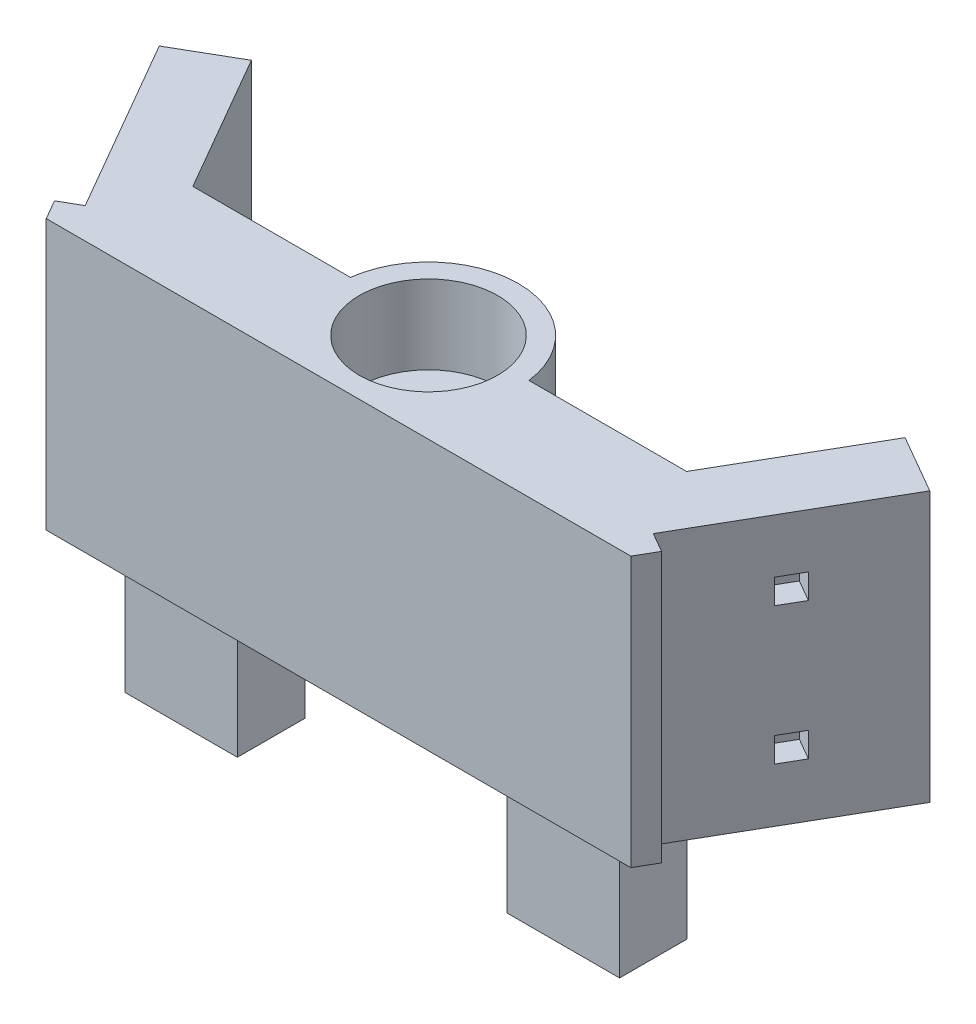
from build123d import *

# Parameters (mm, degrees)
BOSS_EXTRUDE1_DEPTH            = 12
F_2_5_2_5_DIAMETER_HOLE1_D     = 2.5
F_2_5_2_5_DIAMETER_HOLE1_DEPTH = 10
F_2_5_2_5_DIAMETER_HOLE1_TIP   = 0.751075774
SKETCH4_R                      = 3.0762
CUT_EXTRUDE1_DEPTH             = 3.5
SKETCH5_W                      = 5
SKETCH5_H                      = 3
BOSS_EXTRUDE2_DEPTH            = 6
SKETCH7_W                      = 1.1
SKETCH7_H                      = 1.1
CUT_EXTRUDE3_DEPTH             = 1.1
SKETCH8_W                      = 1.1
SKETCH8_H                      = 1.1
CUT_EXTRUDE4_DEPTH             = 1.1


with BuildPart() as part:
    # Sketch1 → Boss-Extrude1 (new body)
    with BuildSketch(Plane(origin=(0, 0, 0), x_dir=(1, 0, 0), z_dir=(0, 1, 0))):
        with BuildLine():
            Line((-13, -4), (13, -4))
            Line((13, -4), (13.5, -3.133974596))
            Line((13.5, -3.133974596), (12.633974596, -2.633974596))
            Line((12.633974596, -2.633974596), (17.133974596, 5.160254038))
            Line((17.133974596, 5.160254038), (14.535898385, 6.660254038))
            Line((14.535898385, 6.660254038), (10.979274058, 0.5))
            Line((10.979274058, 0.5), (3.968626967, 0.5))
            ThreePointArc((3.968626967, 0.5), (0, 4), (-3.968626967, 0.5))
            Line((-3.968626967, 0.5), (-10.979274058, 0.5))
            Line((-10.979274058, 0.5), (-14.535898385, 6.660254038))
            Line((-14.535898385, 6.660254038), (-17.133974596, 5.160254038))
            Line((-17.133974596, 5.160254038), (-12.633974596, -2.633974596))
            Line((-12.633974596, -2.633974596), (-13.5, -3.133974596))
            Line((-13.5, -3.133974596), (-13, -4))
        make_face()
    extrude(amount=BOSS_EXTRUDE1_DEPTH)

    # Ø2.5 (2.5) Diameter Hole1
    with Locations(Plane(origin=(0, 12, 0), x_dir=(1, 0, 0), z_dir=(0, 1, 0))):
        with Locations((0, 0)):
            Hole(F_2_5_2_5_DIAMETER_HOLE1_D / 2, depth=F_2_5_2_5_DIAMETER_HOLE1_DEPTH)
            with Locations((0, 0, -(F_2_5_2_5_DIAMETER_HOLE1_DEPTH + F_2_5_2_5_DIAMETER_HOLE1_TIP / 2))):  # 118° drill point
                Cone(0, F_2_5_2_5_DIAMETER_HOLE1_D / 2, F_2_5_2_5_DIAMETER_HOLE1_TIP, mode=Mode.SUBTRACT)

    # Sketch4 → Cut-Extrude1 (cut)
    with BuildSketch(Plane(origin=(0, 12, 0), x_dir=(1, 0, 0), z_dir=(0, 1, 0))):
        Circle(SKETCH4_R)
    extrude(amount=-CUT_EXTRUDE1_DEPTH, mode=Mode.SUBTRACT)

    # Sketch5 → Boss-Extrude2 (add)
    with BuildSketch(Plane.XZ):
        with Locations((8.5, 1)):
            Rectangle(SKETCH5_W, SKETCH5_H)
        with Locations((-8.5, 1)):
            Rectangle(SKETCH5_W, SKETCH5_H)
    extrude(amount=BOSS_EXTRUDE2_DEPTH)

    # Sketch7 → Cut-Extrude3 (cut)
    with BuildSketch(Plane(origin=(-10.616025404, 0, 6.129165125), x_dir=(0.49999999999999906, 0, 0.8660254037844393), z_dir=(-0.8660254037844392, 0, 0.499999999999999))):
        with Locations((-8.535898385, 9.05)):
            Rectangle(SKETCH7_W, SKETCH7_H)
        with Locations((-8.535898385, 2.95)):
            Rectangle(SKETCH7_W, SKETCH7_H)
    extrude(amount=-CUT_EXTRUDE3_DEPTH, mode=Mode.SUBTRACT)

    # Sketch8 → Cut-Extrude4 (cut)
    with BuildSketch(Plane(origin=(10.616025404, 0, 6.129165125), x_dir=(0.4999999999999978, 0, -0.86602540378444), z_dir=(0.86602540378444, 0, 0.4999999999999978))):
        with Locations((8.535898385, 9.05)):
            Rectangle(SKETCH8_W, SKETCH8_H)
        with Locations((8.535898385, 2.95)):
            Rectangle(SKETCH8_W, SKETCH8_H)
    extrude(amount=-CUT_EXTRUDE4_DEPTH, mode=Mode.SUBTRACT)


solid = part.part
